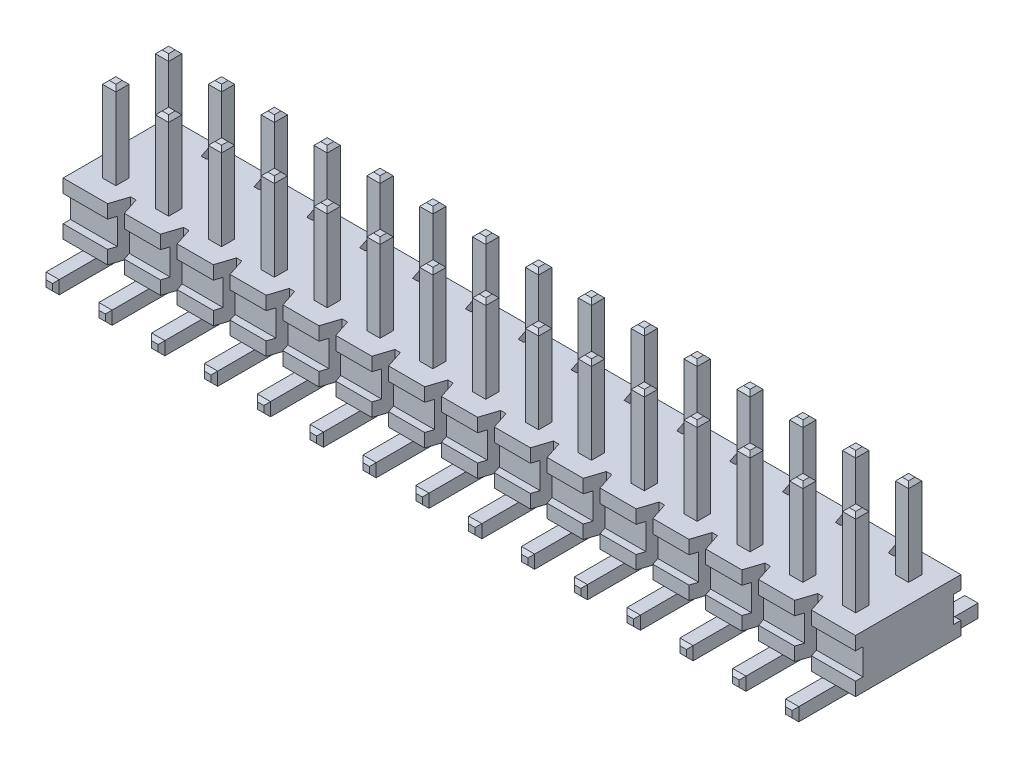
from build123d import *

# Parameters (mm, degrees)
SKETCH1_W                               = 29.9847
SKETCH1_H                               = 3.9878
BODY_DEPTH                              = 1.0033
IN_BETWEEN_CORES_DEPTH                  = 16.256888257
SKETCH4_W                               = 0.2794
SKETCH4_H                               = 0.9906
SIDE_CUT_DEPTH                          = 31.06766506
SKETCH5_W                               = 0.50038
SKETCH5_H                               = 0.50038
CONTACT_DEPTH                           = 3.2004
CONTACT_CHAMFER_SIZE                    = 0.127
CONTACT_PATTERN_COUNT                   = 15
CONTACT_PATTERN_PITCH                   = 2
CONTACT_PATTERN_COUNT_DIR2              = 2
CONTACT_PATTERN_PITCH_DIR2              = 1.999996
CONTACT_CHAMFER_OF_CONTACT_PATTERN_SIZE = 0.127
INBETWEEN_PATTERN_COUNT                 = 14
INBETWEEN_PATTERN_PITCH                 = 2
SM_DEPTH                                = 0.50038
SM_CHAMFER_SIZE                         = 0.127
SM_PATTERN_COUNT                        = 15
SM_PATTERN_PITCH                        = 1.99898
SM_CHAMFER_OF_SM_PATTERN_SIZE           = 0.127


with BuildPart() as part:
    # Sketch1 → Body (new, symmetric)
    with BuildSketch(Plane(origin=(0, 0, 0), x_dir=(1, 0, 0), z_dir=(0, 1, 0))):
        Rectangle(SKETCH1_W, SKETCH1_H)
    extrude(amount=BODY_DEPTH, both=True)

    # Sketch3 → In-Between Cores (cut, through all)
    with BuildSketch(Plane(origin=(0, 1.0033, 0), x_dir=(1, 0, 0), z_dir=(0, 1, 0))):
        Polygon((-13.30985, 1.9939), (-12.67485, 1.9939), (-12.89075, 1.3335), (-13.09395, 1.3335), align=None)
        Polygon((-13.09395, -1.3335), (-13.30985, -1.9939), (-12.67485, -1.9939), (-12.89075, -1.3335), align=None)
    in_between_cores = extrude(amount=-IN_BETWEEN_CORES_DEPTH, mode=Mode.SUBTRACT)

    # Sketch4 → Side Cut (cut, through all)
    with BuildSketch(Plane.ZY.offset(14.99235)):
        with Locations((-1.8542, 0)):
            Rectangle(SKETCH4_W, SKETCH4_H)
        with Locations((1.8542, 0)):
            Rectangle(SKETCH4_W, SKETCH4_H)
    extrude(amount=-SIDE_CUT_DEPTH, mode=Mode.SUBTRACT)

    # Sketch5 → Contact (add)
    with BuildSketch(Plane(origin=(0, 1.0033, 0), x_dir=(1, 0, 0), z_dir=(0, 1, 0))):
        with Locations((-13.99235, -0.999998)):
            Rectangle(SKETCH5_W, SKETCH5_H)
    contact = extrude(amount=CONTACT_DEPTH)

    # Contact Chamfer
    contact_chamfer_edges = [part.edges().sort_by_distance(p)[0] for p in [
        (-13.99235, 4.2037, 0.749808),
        (-13.74216, 4.2037, 0.999998),
        (-13.99235, 4.2037, 1.250188),
        (-14.24254, 4.2037, 0.999998),
    ]]
    chamfer(contact_chamfer_edges, length=CONTACT_CHAMFER_SIZE)

    # Contact Pattern: Contact 15 × 2
    with Locations(*[(i * CONTACT_PATTERN_PITCH, 0, -j * CONTACT_PATTERN_PITCH_DIR2) for i in range(CONTACT_PATTERN_COUNT) for j in range(CONTACT_PATTERN_COUNT_DIR2) if (i, j) != (0, 0)]):
        add(contact)

    # Contact Chamfer of Contact Pattern
    contact_chamfer_of_contact_pattern_edges = [part.edges().sort_by_distance(p)[0] for p in [
        (-13.99235, 4.2037, -1.250188),
        (-13.74216, 4.2037, -0.999998),
        (-13.99235, 4.2037, -0.749808),
        (-14.24254, 4.2037, -0.999998),
        (-11.99235, 4.2037, 0.749808),
        (-11.74216, 4.2037, 0.999998),
        (-11.99235, 4.2037, 1.250188),
        (-12.24254, 4.2037, 0.999998),
        (-11.99235, 4.2037, -1.250188),
        (-11.74216, 4.2037, -0.999998),
        (-11.99235, 4.2037, -0.749808),
        (-12.24254, 4.2037, -0.999998),
        (-9.99235, 4.2037, 0.749808),
        (-9.74216, 4.2037, 0.999998),
        (-9.99235, 4.2037, 1.250188),
        (-10.24254, 4.2037, 0.999998),
        (-9.99235, 4.2037, -1.250188),
        (-9.74216, 4.2037, -0.999998),
        (-9.99235, 4.2037, -0.749808),
        (-10.24254, 4.2037, -0.999998),
        (-7.99235, 4.2037, 0.749808),
        (-7.74216, 4.2037, 0.999998),
        (-7.99235, 4.2037, 1.250188),
        (-8.24254, 4.2037, 0.999998),
        (-7.99235, 4.2037, -1.250188),
        (-7.74216, 4.2037, -0.999998),
        (-7.99235, 4.2037, -0.749808),
        (-8.24254, 4.2037, -0.999998),
        (-5.99235, 4.2037, 0.749808),
        (-5.74216, 4.2037, 0.999998),
        (-5.99235, 4.2037, 1.250188),
        (-6.24254, 4.2037, 0.999998),
        (-5.99235, 4.2037, -1.250188),
        (-5.74216, 4.2037, -0.999998),
        (-5.99235, 4.2037, -0.749808),
        (-6.24254, 4.2037, -0.999998),
        (-3.99235, 4.2037, 0.749808),
        (-3.74216, 4.2037, 0.999998),
        (-3.99235, 4.2037, 1.250188),
        (-4.24254, 4.2037, 0.999998),
        (-3.99235, 4.2037, -1.250188),
        (-3.74216, 4.2037, -0.999998),
        (-3.99235, 4.2037, -0.749808),
        (-4.24254, 4.2037, -0.999998),
        (-1.99235, 4.2037, 0.749808),
        (-1.74216, 4.2037, 0.999998),
        (-1.99235, 4.2037, 1.250188),
        (-2.24254, 4.2037, 0.999998),
        (-1.99235, 4.2037, -1.250188),
        (-1.74216, 4.2037, -0.999998),
        (-1.99235, 4.2037, -0.749808),
        (-2.24254, 4.2037, -0.999998),
        (0.00765, 4.2037, 0.749808),
        (0.25784, 4.2037, 0.999998),
        (0.00765, 4.2037, 1.250188),
        (-0.24254, 4.2037, 0.999998),
        (0.00765, 4.2037, -1.250188),
        (0.25784, 4.2037, -0.999998),
        (0.00765, 4.2037, -0.749808),
        (-0.24254, 4.2037, -0.999998),
        (2.00765, 4.2037, 0.749808),
        (2.25784, 4.2037, 0.999998),
        (2.00765, 4.2037, 1.250188),
        (1.75746, 4.2037, 0.999998),
        (2.00765, 4.2037, -1.250188),
        (2.25784, 4.2037, -0.999998),
        (2.00765, 4.2037, -0.749808),
        (1.75746, 4.2037, -0.999998),
        (4.00765, 4.2037, 0.749808),
        (4.25784, 4.2037, 0.999998),
        (4.00765, 4.2037, 1.250188),
        (3.75746, 4.2037, 0.999998),
        (4.00765, 4.2037, -1.250188),
        (4.25784, 4.2037, -0.999998),
        (4.00765, 4.2037, -0.749808),
        (3.75746, 4.2037, -0.999998),
        (6.00765, 4.2037, 0.749808),
        (6.25784, 4.2037, 0.999998),
        (6.00765, 4.2037, 1.250188),
        (5.75746, 4.2037, 0.999998),
        (6.00765, 4.2037, -1.250188),
        (6.25784, 4.2037, -0.999998),
        (6.00765, 4.2037, -0.749808),
        (5.75746, 4.2037, -0.999998),
        (8.00765, 4.2037, 0.749808),
        (8.25784, 4.2037, 0.999998),
        (8.00765, 4.2037, 1.250188),
        (7.75746, 4.2037, 0.999998),
        (8.00765, 4.2037, -1.250188),
        (8.25784, 4.2037, -0.999998),
        (8.00765, 4.2037, -0.749808),
        (7.75746, 4.2037, -0.999998),
        (10.00765, 4.2037, 0.749808),
        (10.25784, 4.2037, 0.999998),
        (10.00765, 4.2037, 1.250188),
        (9.75746, 4.2037, 0.999998),
        (10.00765, 4.2037, -1.250188),
        (10.25784, 4.2037, -0.999998),
        (10.00765, 4.2037, -0.749808),
        (9.75746, 4.2037, -0.999998),
        (12.00765, 4.2037, 0.749808),
        (12.25784, 4.2037, 0.999998),
        (12.00765, 4.2037, 1.250188),
        (11.75746, 4.2037, 0.999998),
        (12.00765, 4.2037, -1.250188),
        (12.25784, 4.2037, -0.999998),
        (12.00765, 4.2037, -0.749808),
        (11.75746, 4.2037, -0.999998),
        (14.00765, 4.2037, 0.749808),
        (14.25784, 4.2037, 0.999998),
        (14.00765, 4.2037, 1.250188),
        (13.75746, 4.2037, 0.999998),
        (14.00765, 4.2037, -1.250188),
        (14.25784, 4.2037, -0.999998),
        (14.00765, 4.2037, -0.749808),
        (13.75746, 4.2037, -0.999998),
    ]]
    chamfer(contact_chamfer_of_contact_pattern_edges, length=CONTACT_CHAMFER_OF_CONTACT_PATTERN_SIZE)

    # Inbetween Pattern: In-Between Cores ×14
    with Locations(*[(i * INBETWEEN_PATTERN_PITCH, 0, 0) for i in range(1, INBETWEEN_PATTERN_COUNT)]):
        add(in_between_cores, mode=Mode.SUBTRACT)

    # Sketch6 → SM (add)
    with BuildSketch(Plane.ZY.offset(14.24254)):
        with BuildLine():
            Line((-1.250188, -1.0033), (-3.5179, -1.0033))
            Line((-3.5179, -1.0033), (-3.5179, -1.50368))
            Line((-3.5179, -1.50368), (-1.250188, -1.50368))
            ThreePointArc((-1.250188, -1.50368), (-0.896365909, -1.357122091), (-0.749808, -1.0033))
            Line((-0.749808, -1.0033), (-1.250188, -1.0033))
        make_face()
        with BuildLine():
            Line((1.250188, -1.0033), (0.749808, -1.0033))
            ThreePointArc((0.749808, -1.0033), (0.896365909, -1.357122091), (1.250188, -1.50368))
            Line((1.250188, -1.50368), (3.5179, -1.50368))
            Line((3.5179, -1.50368), (3.5179, -1.0033))
            Line((3.5179, -1.0033), (1.250188, -1.0033))
        make_face()
    sm = extrude(amount=-SM_DEPTH)

    # SM Chamfer
    sm_chamfer_edges = [part.edges().sort_by_distance(p)[0] for p in [
        (-13.99235, -1.0033, 3.5179),
        (-13.74216, -1.25349, 3.5179),
        (-13.99235, -1.50368, 3.5179),
        (-14.24254, -1.25349, 3.5179),
        (-13.99235, -1.50368, -3.5179),
        (-13.74216, -1.25349, -3.5179),
        (-13.99235, -1.0033, -3.5179),
        (-14.24254, -1.25349, -3.5179),
    ]]
    chamfer(sm_chamfer_edges, length=SM_CHAMFER_SIZE)

    # SM Pattern: SM ×15
    with Locations(*[(i * SM_PATTERN_PITCH, 0, 0) for i in range(1, SM_PATTERN_COUNT)]):
        add(sm)

    # SM Chamfer of SM Pattern
    sm_chamfer_of_sm_pattern_edges = [part.edges().sort_by_distance(p)[0] for p in [
        (-11.99337, -1.0033, 3.5179),
        (-11.74318, -1.25349, 3.5179),
        (-11.99337, -1.50368, 3.5179),
        (-12.24356, -1.25349, 3.5179),
        (-11.99337, -1.50368, -3.5179),
        (-11.74318, -1.25349, -3.5179),
        (-11.99337, -1.0033, -3.5179),
        (-12.24356, -1.25349, -3.5179),
        (-9.99439, -1.0033, 3.5179),
        (-9.7442, -1.25349, 3.5179),
        (-9.99439, -1.50368, 3.5179),
        (-10.24458, -1.25349, 3.5179),
        (-9.99439, -1.50368, -3.5179),
        (-9.7442, -1.25349, -3.5179),
        (-9.99439, -1.0033, -3.5179),
        (-10.24458, -1.25349, -3.5179),
        (-7.99541, -1.0033, 3.5179),
        (-7.74522, -1.25349, 3.5179),
        (-7.99541, -1.50368, 3.5179),
        (-8.2456, -1.25349, 3.5179),
        (-7.99541, -1.50368, -3.5179),
        (-7.74522, -1.25349, -3.5179),
        (-7.99541, -1.0033, -3.5179),
        (-8.2456, -1.25349, -3.5179),
        (-5.99643, -1.0033, 3.5179),
        (-5.74624, -1.25349, 3.5179),
        (-5.99643, -1.50368, 3.5179),
        (-6.24662, -1.25349, 3.5179),
        (-5.99643, -1.50368, -3.5179),
        (-5.74624, -1.25349, -3.5179),
        (-5.99643, -1.0033, -3.5179),
        (-6.24662, -1.25349, -3.5179),
        (-3.99745, -1.0033, 3.5179),
        (-3.74726, -1.25349, 3.5179),
        (-3.99745, -1.50368, 3.5179),
        (-4.24764, -1.25349, 3.5179),
        (-3.99745, -1.50368, -3.5179),
        (-3.74726, -1.25349, -3.5179),
        (-3.99745, -1.0033, -3.5179),
        (-4.24764, -1.25349, -3.5179),
        (-1.99847, -1.0033, 3.5179),
        (-1.74828, -1.25349, 3.5179),
        (-1.99847, -1.50368, 3.5179),
        (-2.24866, -1.25349, 3.5179),
        (-1.99847, -1.50368, -3.5179),
        (-1.74828, -1.25349, -3.5179),
        (-1.99847, -1.0033, -3.5179),
        (-2.24866, -1.25349, -3.5179),
        (0.00051, -1.0033, 3.5179),
        (0.2507, -1.25349, 3.5179),
        (0.00051, -1.50368, 3.5179),
        (-0.24968, -1.25349, 3.5179),
        (0.00051, -1.50368, -3.5179),
        (0.2507, -1.25349, -3.5179),
        (0.00051, -1.0033, -3.5179),
        (-0.24968, -1.25349, -3.5179),
        (1.99949, -1.0033, 3.5179),
        (2.24968, -1.25349, 3.5179),
        (1.99949, -1.50368, 3.5179),
        (1.7493, -1.25349, 3.5179),
        (1.99949, -1.50368, -3.5179),
        (2.24968, -1.25349, -3.5179),
        (1.99949, -1.0033, -3.5179),
        (1.7493, -1.25349, -3.5179),
        (3.99847, -1.0033, 3.5179),
        (4.24866, -1.25349, 3.5179),
        (3.99847, -1.50368, 3.5179),
        (3.74828, -1.25349, 3.5179),
        (3.99847, -1.50368, -3.5179),
        (4.24866, -1.25349, -3.5179),
        (3.99847, -1.0033, -3.5179),
        (3.74828, -1.25349, -3.5179),
        (5.99745, -1.0033, 3.5179),
        (6.24764, -1.25349, 3.5179),
        (5.99745, -1.50368, 3.5179),
        (5.74726, -1.25349, 3.5179),
        (5.99745, -1.50368, -3.5179),
        (6.24764, -1.25349, -3.5179),
        (5.99745, -1.0033, -3.5179),
        (5.74726, -1.25349, -3.5179),
        (7.99643, -1.0033, 3.5179),
        (8.24662, -1.25349, 3.5179),
        (7.99643, -1.50368, 3.5179),
        (7.74624, -1.25349, 3.5179),
        (7.99643, -1.50368, -3.5179),
        (8.24662, -1.25349, -3.5179),
        (7.99643, -1.0033, -3.5179),
        (7.74624, -1.25349, -3.5179),
        (9.99541, -1.0033, 3.5179),
        (10.2456, -1.25349, 3.5179),
        (9.99541, -1.50368, 3.5179),
        (9.74522, -1.25349, 3.5179),
        (9.99541, -1.50368, -3.5179),
        (10.2456, -1.25349, -3.5179),
        (9.99541, -1.0033, -3.5179),
        (9.74522, -1.25349, -3.5179),
        (11.99439, -1.0033, 3.5179),
        (12.24458, -1.25349, 3.5179),
        (11.99439, -1.50368, 3.5179),
        (11.7442, -1.25349, 3.5179),
        (11.99439, -1.50368, -3.5179),
        (12.24458, -1.25349, -3.5179),
        (11.99439, -1.0033, -3.5179),
        (11.7442, -1.25349, -3.5179),
        (13.99337, -1.0033, 3.5179),
        (14.24356, -1.25349, 3.5179),
        (13.99337, -1.50368, 3.5179),
        (13.74318, -1.25349, 3.5179),
        (13.99337, -1.50368, -3.5179),
        (14.24356, -1.25349, -3.5179),
        (13.99337, -1.0033, -3.5179),
        (13.74318, -1.25349, -3.5179),
    ]]
    chamfer(sm_chamfer_of_sm_pattern_edges, length=SM_CHAMFER_OF_SM_PATTERN_SIZE)


solid = part.part
